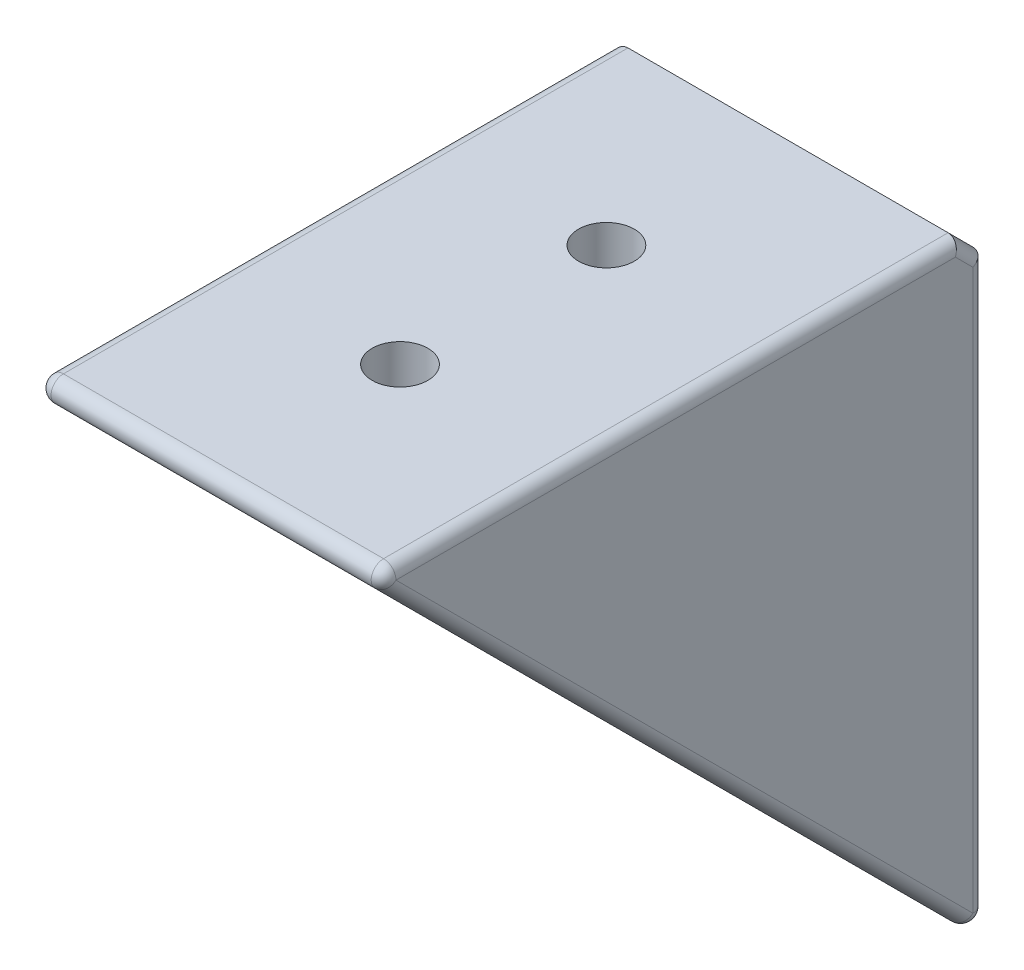
from build123d import *

# Parameters (mm, degrees)
BOSS_EXTRUDE1_DEPTH  = 13.925
M4_CLEARANCE_HOLE1_D = 4.5
CUT_EXTRUDE1_START   = -5
SKETCH7_R            = 4.25
CUT_EXTRUDE1_DEPTH   = 62
CHAMFER1_SIZE        = 2
MIRROR1_START        = -33.333333
MIRROR1_OUTLINE_R    = 4.25
MIRROR1_DEPTH        = 28.333333
MIRROR1_START_2      = -5
MIRROR1_2_OUTLINE_R  = 2.25
MIRROR1_2_DEPTH      = 5
CUT_EXTRUDE4_START   = -18.175
CUT_EXTRUDE4_DEPTH   = 8.5
FILLET1_R            = 1


# Read off the part's stored shape, not the designer's step: Mirror1
with BuildPart() as part:
    # Sketch1 → Boss-Extrude1 (new, symmetric)
    with BuildSketch(Plane(origin=(0, 0, 0), x_dir=(0, 0, -1), z_dir=(1, 0, 0))):
        Polygon((0, 0), (-50, 0), (0, -50), align=None)
    extrude(amount=BOSS_EXTRUDE1_DEPTH, both=True)

    # M4 Clearance Hole1 (through all)
    with Locations(Plane(origin=(0, 0, 0), x_dir=(-1, 0, 0), z_dir=(0, 0, -1))):
        with Locations((0, -16.666667), (0, -33.333333)):
            Hole(M4_CLEARANCE_HOLE1_D / 2)

    # Sketch7 → Cut-Extrude1 (cut)
    with BuildSketch(Plane(origin=(0, 0, 0), x_dir=(-1, 0, 0), z_dir=(0, 0, -1)).offset(CUT_EXTRUDE1_START)):
        with Locations((0, -16.666667)):
            Circle(SKETCH7_R)
        with Locations((0, -33.333333)):
            Circle(SKETCH7_R)
    extrude(amount=-CUT_EXTRUDE1_DEPTH, mode=Mode.SUBTRACT)

    # Chamfer1
    chamfer1_edges = [part.edges().sort_by_distance(p)[0] for p in [
        (0, 0, 0),
    ]]
    chamfer(chamfer1_edges, length=CHAMFER1_SIZE)

    # Mirror1 outline → Mirror1 (cut)
    with BuildSketch(Plane(origin=(0, 0, 0), x_dir=(1, 0, 0), z_dir=(0, 1, 0)).offset(MIRROR1_START)):
        with Locations((0, -33.333333)):
            Circle(MIRROR1_OUTLINE_R)
        with Locations((0, -16.666667)):
            Circle(MIRROR1_OUTLINE_R)
    extrude(amount=MIRROR1_DEPTH, mode=Mode.SUBTRACT)

    # Mirror1 2 outline → Mirror1 2 (cut)
    with BuildSketch(Plane(origin=(0, 0, 0), x_dir=(1, 0, 0), z_dir=(0, 1, 0)).offset(MIRROR1_START_2)):
        with Locations((0, -33.333333)):
            Circle(MIRROR1_2_OUTLINE_R)
        with Locations((0, -16.666667)):
            Circle(MIRROR1_2_OUTLINE_R)
    extrude(amount=MIRROR1_2_DEPTH, mode=Mode.SUBTRACT)

    # Sketch8 → Cut-Extrude4 (cut)
    with BuildSketch(Plane(origin=(13.925, 0, 0), x_dir=(0, 0, -1), z_dir=(1, 0, 0)).offset(CUT_EXTRUDE4_START)):
        Polygon((-33.333333, -16.666667), (-16.666667, -16.666667), (-16.666667, -33.333333), align=None)
    extrude(amount=CUT_EXTRUDE4_DEPTH, mode=Mode.SUBTRACT)

    # Fillet1
    fillet1_edges = [part.edges().sort_by_distance(p)[0] for p in [
        (13.925, -25, 25),
        (-13.925, 0, 26),
        (13.925, 0, 26),
        (-13.925, -1, 1),
        (-13.925, -25, 25),
        (13.925, -1, 1),
        (-13.925, -26, 0),
        (13.925, -26, 0),
        (0, -50, 0),
        (0, 0, 50),
    ]]
    fillet(fillet1_edges, radius=FILLET1_R)


solid = part.part
